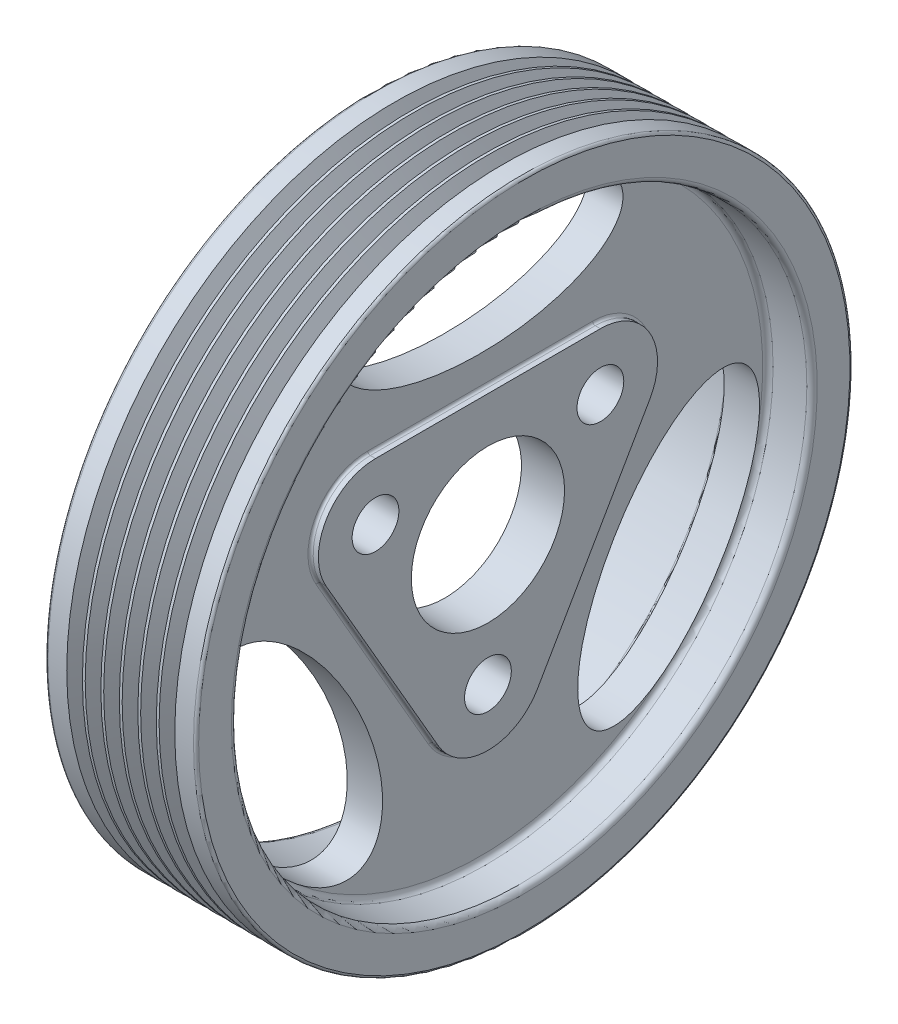
from build123d import *
from build123d.topology import SkipClean

# Parameters (mm, degrees)
FILLET_1_R               = 1
FILLET_2_R               = 0.5
CUT_EXTRUDE_1_DEPTH      = 91.678387723
CUT_EXTRUDE_1_DEPTH_BACK = 91.678387723
SKETCH_3_R               = 4.5
SKETCH_3_RX              = 27.5
SKETCH_3_RY              = 12.5
SKETCH_4_R               = 4.5
SKETCH_4_R_2             = 14.75
EXTRUDE_1_DEPTH          = 1.5
FILLET_3_R               = 0.5
SKETCH_5_R               = 8
CUT_EXTRUDE_2_DEPTH      = 1


with BuildPart() as part:
    # Эскиз1 → Повернуть1 (revolve)
    with BuildSketch(Plane.XY):
        Polygon((13.7, 14.75), (20.5, 14.75), (20.5, 55.4), (29, 55.4), (29, 63.2), (0, 63.2), (0, 55.4), (13.7, 55.4), align=None)
    revolve(axis=Axis((-584.151441429, 0, 0), (1, 0, 0)))

    # Скругление1
    fillet_1_edges = [part.edges().sort_by_distance(p)[0] for p in [
        (0, -55.4, 0),
        (13.7, -55.4, 0),
        (20.5, -55.4, 0),
        (29, -55.4, 0),
    ]]
    fillet(fillet_1_edges, radius=FILLET_1_R)

    # Скругление2
    fillet_2_edges = [part.edges().sort_by_distance(p)[0] for p in [
        (29, -63.2, 0),
        (0, -63.2, 0),
    ]]
    fillet(fillet_2_edges, radius=FILLET_2_R)


with BuildPart() as body_2:
    # Эскиз2 → Повернуть2 (revolve)
    with BuildSketch(Plane(origin=(0, 0, 0), x_dir=(1, 0, 0), z_dir=(0, 1, 0))):
        Polygon((3.82852215, 63.7), (5.607101792, 60.424263798), (7.385681433, 63.7), (9.164261075, 60.424263798), (10.942840717, 63.7), (12.721420358, 60.424263798), (14.5, 63.7), (16.278579642, 60.424263798), (18.057159283, 63.7), (19.835738925, 60.424263798), (21.614318567, 63.7), (23.392898208, 60.424263798), (25.17147785, 63.7), (25.17147785, 68.7), (3.82852215, 68.7), align=None)
    revolve(axis=Axis((-584.151441429, 0, 0), (1, 0, 0)))


with BuildPart() as part_1:
    add(part.part)

    # Combine 1: cut body 2
    add(body_2.part, mode=Mode.SUBTRACT)

    # Эскиз3 → Вырез-Вытянуть1 (cut, two sides: drawn at the far end of the back side and taken through both)
    with BuildSketch(Plane.ZY.offset(-13.7).offset(-CUT_EXTRUDE_1_DEPTH_BACK)):
        with Locations((0, -25)):
            Circle(SKETCH_3_R)
        with Locations((-21.650635095, 12.5)):
            Circle(SKETCH_3_R)
        with Locations((21.650635095, 12.5)):
            Circle(SKETCH_3_R)
        with Locations((0, 41.9)):
            Ellipse(SKETCH_3_RX, SKETCH_3_RY)
        with Locations(Location((36.286464419, -20.95), (0, 0, -120))):
            Ellipse(SKETCH_3_RX, SKETCH_3_RY)
        with Locations(Location((-36.286464419, -20.95), (0, 0, 120))):
            Ellipse(SKETCH_3_RX, SKETCH_3_RY)
    extrude(amount=CUT_EXTRUDE_1_DEPTH + CUT_EXTRUDE_1_DEPTH_BACK, mode=Mode.SUBTRACT)

    # Эскиз4 → Бобышка-Вытянуть1 (add)
    with SkipClean():  # the faces are left unmerged after this step: merging them gives an invalid solid
        with BuildSketch(Plane(origin=(20.5, 0, 0), x_dir=(0, 0, -1), z_dir=(1, 0, 0))):
            with BuildLine():
                Line((-21.650635095, 23.5), (21.650635095, 23.5))
                ThreePointArc((21.650635095, 23.5), (31.176914536, 18), (31.176914536, 7))
                Line((31.176914536, 7), (9.526279442, -30.5))
                ThreePointArc((9.526279442, -30.5), (0, -36), (-9.526279442, -30.5))
                Line((-9.526279442, -30.5), (-31.176914536, 7))
                ThreePointArc((-31.176914536, 7), (-31.176914536, 18), (-21.650635095, 23.5))
            make_face()
            with Locations((21.650635095, 12.5)):
                Circle(SKETCH_4_R, mode=Mode.SUBTRACT)
            with Locations((0, -25)):
                Circle(SKETCH_4_R, mode=Mode.SUBTRACT)
            with Locations((-21.650635095, 12.5)):
                Circle(SKETCH_4_R, mode=Mode.SUBTRACT)
            Circle(SKETCH_4_R_2, mode=Mode.SUBTRACT)
        extrude(amount=EXTRUDE_1_DEPTH)

    # Скругление3
    fillet_3_edges = [part_1.edges().sort_by_distance(p)[0] for p in [
        (20.5, 18, -31.176914536),
        (20.5, -11.75, -20.351596989),
        (20.5, -36, 0),
        (20.5, -11.75, 20.351596989),
        (20.5, 18, 31.176914536),
        (20.5, 23.5, 0),
    ]]
    fillet(fillet_3_edges, radius=FILLET_3_R)

    # Эскиз5 → Вырез-Вытянуть2 (cut)
    with BuildSketch(Plane.ZY.offset(-13.7)):
        with Locations((-21.650635095, 12.5)):
            Circle(SKETCH_5_R)
        with Locations((21.650635095, 12.5)):
            Circle(SKETCH_5_R)
        with Locations((0, -25)):
            Circle(SKETCH_5_R)
    extrude(amount=-CUT_EXTRUDE_2_DEPTH, mode=Mode.SUBTRACT)


solid = part_1.part
